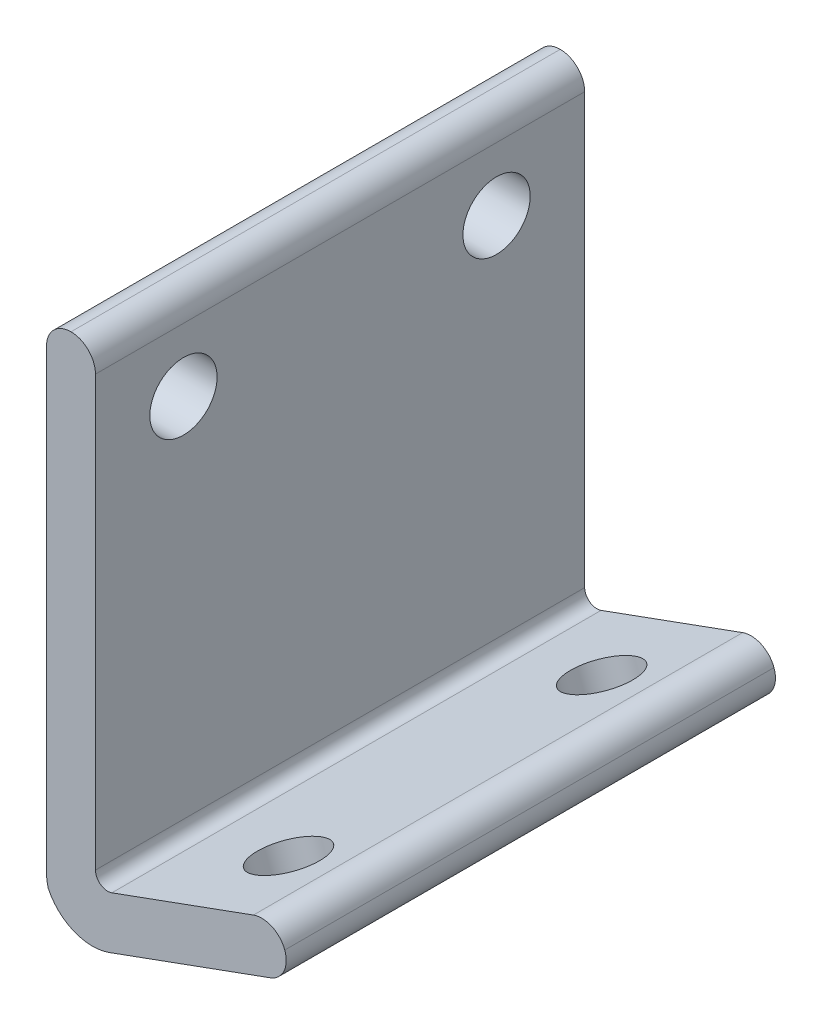
from build123d import *

# Parameters (mm, degrees)
SKETCH3_W           = 20
SKETCH3_H           = 10
SKETCH3_R           = 1.35
BOSS_EXTRUDE1_DEPTH = 2
SKETCH2_W           = 20
SKETCH2_H           = 20
SKETCH2_R           = 1.375
BOSS_EXTRUDE2_DEPTH = 2
FILLET1_R           = 2
FILLET2_R           = 0.5
FILLET3_R           = 1
FILLET4_R           = 1


# Some blends are built 0.0001 mm under size
with BuildPart() as part:
    # Sketch3 → Boss-Extrude1 (new body)
    with BuildSketch(Plane(origin=(0, 0, 0), x_dir=(0, 0, -1), z_dir=(0.34202014332566616, -0.9396926207859094, 0))):
        with Locations((10, 5)):
            Rectangle(SKETCH3_W, SKETCH3_H)
        with Locations(Location((3.6, 6.69633816, 0), (0, 0, 90))):
            Circle(SKETCH3_R, mode=Mode.SUBTRACT)
        with Locations(Location((16.4, 6.69633816, 0), (0, 0, 90))):
            Circle(SKETCH3_R, mode=Mode.SUBTRACT)
    extrude(amount=BOSS_EXTRUDE1_DEPTH)

    # Sketch2 → Boss-Extrude2 (add)
    with BuildSketch(Plane(origin=(0, 0, 0), x_dir=(0, 0, -1), z_dir=(1, 0, 0))):
        with Locations((10, 10)):
            Rectangle(SKETCH2_W, SKETCH2_H)
        with Locations((3.597100601, 16.415608196)):
            Circle(SKETCH2_R, mode=Mode.SUBTRACT)
        with Locations((16.397100601, 16.415608196)):
            Circle(SKETCH2_R, mode=Mode.SUBTRACT)
    extrude(amount=BOSS_EXTRUDE2_DEPTH)

    # Fillet1
    # the kernel refuses this fillet: 2 mm, written as the material it takes off along each edge
    with BuildSketch(Plane(origin=(0.684040287, -1.879385242, -25), x_dir=(0.9396926207859093, 0.34202014332566616, 0), z_dir=(0, 0, 1))) as fillet1_piece_1:
        with BuildLine():
            CenterArc((FILLET1_R, FILLET1_R), FILLET1_R, 180, 90)
            Line((0, FILLET1_R), (0, 0))
            Line((0, 0), (FILLET1_R, 0))
        make_face()
    extrude(amount=30, mode=Mode.SUBTRACT)
    with BuildSketch(Plane(origin=(0, 0, -20.881634904), x_dir=(0.34202014332566616, -0.9396926207859093, 0), z_dir=(0, 0, 1))) as fillet1_piece_2:
        with BuildLine():
            CenterArc((FILLET1_R * 0.176326980708, FILLET1_R), FILLET1_R, 250, 20)
            Line((-FILLET1_R * 0.165693162617, FILLET1_R * 0.0603073792141), (0, 0))
            Line((0, 0), (FILLET1_R * 0.176326980708, 0))
        make_face()
    extrude(amount=21.763269807, mode=Mode.SUBTRACT)

    # Fillet2
    fillet2_edges = [part.edges().sort_by_distance(p)[0] for p in [
        (2, 0.727940469, -10),
    ]]
    fillet(fillet2_edges, radius=FILLET2_R)

    # Fillet3
    fillet3_edges = [part.edges().sort_by_distance(p)[0] for p in [
        (2, 20, -10),
        (0, 20, -10),
    ]]
    fillet(fillet3_edges, radius=FILLET3_R - 0.0001)  # a hair under: the kernel refuses the full size

    # Fillet4
    fillet4_edges = [part.edges().sort_by_distance(p)[0] for p in [
        (10.080966495, 1.540816192, -10),
        (9.396926208, 3.420201433, -10),
    ]]
    fillet(fillet4_edges, radius=FILLET4_R - 0.0001)  # a hair under: the kernel refuses the full size


solid = part.part
